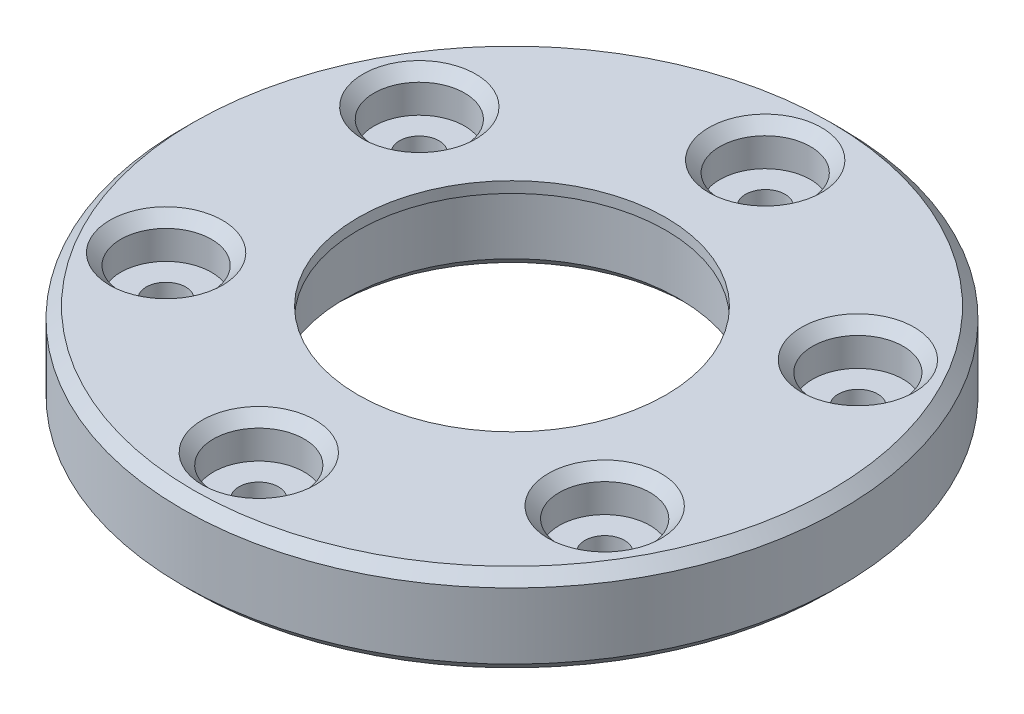
from build123d import *

# Parameters (mm, degrees)
SKETCH_1_R          = 15
SKETCH_1_R_2        = 7
SKETCH_1_R_3        = 2.065
EXTRUDE_1_DEPTH     = 1.8
EXTRUDE_START       = 2.2
SKETCH_2_R          = 15
SKETCH_2_R_2        = 7
SKETCH_2_R_3        = 0.9
EXTRUDE_2_DEPTH     = 2.2
SKETCH_3_R          = 7.6
CUT_EXTRUDE_1_DEPTH = 3.5
CHAMFER_1_SIZE      = 0.5
CHAMFER_2_SIZE      = 0.3


with BuildPart() as part:
    # 草图1 → 凸台-拉伸1 (new body)
    with BuildSketch(Plane(origin=(0, 0, 0), x_dir=(1, 0, 0), z_dir=(0, 1, 0))):
        Circle(SKETCH_1_R)
        Circle(SKETCH_1_R_2, mode=Mode.SUBTRACT)
        with Locations((0, 11.525)):
            Circle(SKETCH_1_R_3, mode=Mode.SUBTRACT)
        with Locations((9.980942779, 5.7625)):
            Circle(SKETCH_1_R_3, mode=Mode.SUBTRACT)
        with Locations((9.980942779, -5.7625)):
            Circle(SKETCH_1_R_3, mode=Mode.SUBTRACT)
        with Locations((0, -11.525)):
            Circle(SKETCH_1_R_3, mode=Mode.SUBTRACT)
        with Locations((-9.980942779, -5.7625)):
            Circle(SKETCH_1_R_3, mode=Mode.SUBTRACT)
        with Locations((-9.980942779, 5.7625)):
            Circle(SKETCH_1_R_3, mode=Mode.SUBTRACT)
    extrude(amount=EXTRUDE_1_DEPTH)

    # 草图2 → 凸台-拉伸2 (add)
    with BuildSketch(Plane(origin=(0, 0, 0), x_dir=(-1, 0, 0), z_dir=(0, -1, 0)).offset(EXTRUDE_START)):
        Circle(SKETCH_2_R)
        Circle(SKETCH_2_R_2, mode=Mode.SUBTRACT)
        with Locations((0, 11.53)):
            Circle(SKETCH_2_R_3, mode=Mode.SUBTRACT)
        with Locations((9.985272906, 5.765)):
            Circle(SKETCH_2_R_3, mode=Mode.SUBTRACT)
        with Locations((9.985272906, -5.765)):
            Circle(SKETCH_2_R_3, mode=Mode.SUBTRACT)
        with Locations((0, -11.53)):
            Circle(SKETCH_2_R_3, mode=Mode.SUBTRACT)
        with Locations((-9.985272906, -5.765)):
            Circle(SKETCH_2_R_3, mode=Mode.SUBTRACT)
        with Locations((-9.985272906, 5.765)):
            Circle(SKETCH_2_R_3, mode=Mode.SUBTRACT)
    extrude(amount=-EXTRUDE_2_DEPTH)

    # 草图3 → 切除-拉伸1 (cut)
    with BuildSketch(Plane(origin=(0, -2.2, 0), x_dir=(-1, 0, 0), z_dir=(0, -1, 0))):
        Circle(SKETCH_3_R)
    extrude(amount=-CUT_EXTRUDE_1_DEPTH, mode=Mode.SUBTRACT)

    # 倒角1
    chamfer_1_edges = [part.edges().sort_by_distance(p)[0] for p in [
        (15, -2.2, 0),
        (-12.045942779, 1.8, -5.7625),
        (-2.065, 1.8, 11.525),
        (7.915942779, 1.8, -5.7625),
        (-15, 1.8, 0),
        (-2.065, 1.8, -11.525),
        (7.915942779, 1.8, 5.7625),
        (-12.045942779, 1.8, 5.7625),
        (10.885272906, -2.2, -5.765),
        (0.9, -2.2, 11.53),
        (-9.085272906, -2.2, -5.765),
        (0.9, -2.2, -11.53),
        (-9.085272906, -2.2, 5.765),
        (10.885272906, -2.2, 5.765),
        (7.6, -2.2, 0),
    ]]
    chamfer(chamfer_1_edges, length=CHAMFER_1_SIZE)

    # 倒角2
    chamfer_2_edges = [part.edges().sort_by_distance(p)[0] for p in [
        (7.6, 1.3, 0),
    ]]
    chamfer(chamfer_2_edges, length=CHAMFER_2_SIZE)


solid = part.part
